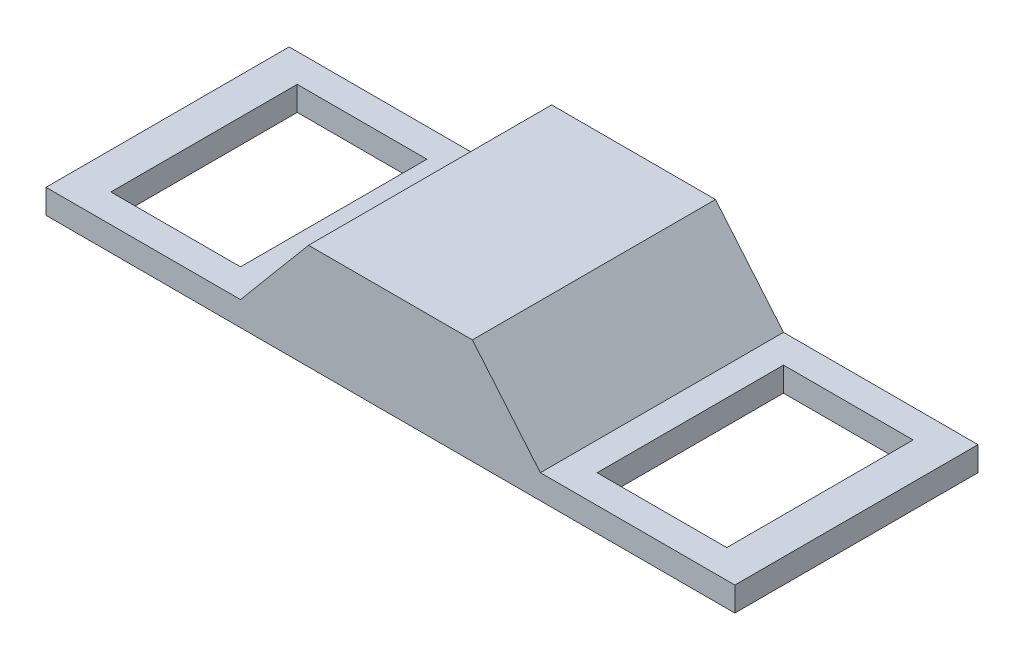
from build123d import *
from OCP.BRepFilletAPI import BRepFilletAPI_MakeChamfer

# Parameters (mm, degrees)
CROQUIS1_W              = 85
CROQUIS1_H              = 30
CROQUIS1_W_2            = 16
CROQUIS1_H_2            = 23
SALIENTE_EXTRUIR1_DEPTH = 3
CROQUIS3_W              = 37
CROQUIS3_H              = 30
SALIENTE_EXTRUIR2_DEPTH = 10
CHAFL_N1_SIZE           = 10
CHAFL_N1_SIZE_2         = 8.390996312


with BuildPart() as part:
    # Croquis1 → Saliente-Extruir1 (new body)
    with BuildSketch(Plane(origin=(0, 0, 0), x_dir=(1, 0, 0), z_dir=(0, 1, 0))):
        Rectangle(CROQUIS1_W, CROQUIS1_H)
        with Locations((30, 0)):
            Rectangle(CROQUIS1_W_2, CROQUIS1_H_2, mode=Mode.SUBTRACT)
        with Locations((-30, 0)):
            Rectangle(CROQUIS1_W_2, CROQUIS1_H_2, mode=Mode.SUBTRACT)
    extrude(amount=SALIENTE_EXTRUIR1_DEPTH)

    # Croquis3 → Saliente-Extruir2 (add)
    with BuildSketch(Plane(origin=(0, 3, 0), x_dir=(1, 0, 0), z_dir=(0, 1, 0))):
        Rectangle(CROQUIS3_W, CROQUIS3_H)
    extrude(amount=SALIENTE_EXTRUIR2_DEPTH)

    # Chaflán1
    chafl_n1_edges_1 = [part.edges().sort_by_distance(p)[0] for p in [
        (18.5, 13, 0),
    ]]
    chafl_n1_side_1 = [part.faces().sort_by_distance(p)[0] for p in [
        (18.5, 12.832180074, 0),
    ]]
    chafl_n1_edges_2 = [part.edges().sort_by_distance(p)[0] for p in [
        (-18.5, 13, 0),
    ]]
    chafl_n1_side_2 = [part.faces().sort_by_distance(p)[0] for p in [
        (-18.5, 12.832180074, 0),
    ]]
    chafl_n1 = BRepFilletAPI_MakeChamfer(part.part.solid().wrapped)
    for e in chafl_n1_edges_1:
        chafl_n1.Add(CHAFL_N1_SIZE - 0.0001, CHAFL_N1_SIZE_2 - 0.0001, e.wrapped, chafl_n1_side_1[0].wrapped)
    for e in chafl_n1_edges_2:
        chafl_n1.Add(CHAFL_N1_SIZE - 0.0001, CHAFL_N1_SIZE_2 - 0.0001, e.wrapped, chafl_n1_side_2[0].wrapped)
    add(Compound.cast(chafl_n1.Shape()), mode=Mode.REPLACE)  # a hair under: the kernel refuses the full size


solid = part.part
